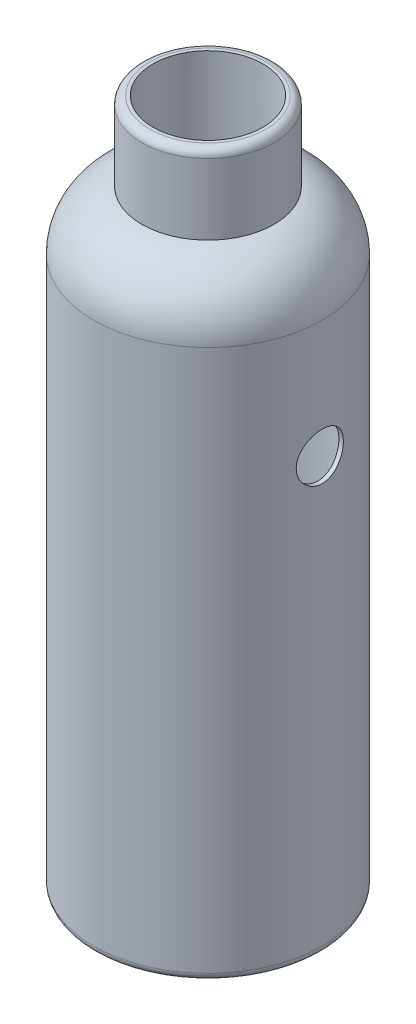
from build123d import *

# Parameters (mm, degrees)
SKETCH1_R               = 36.96335
BOSS_EXTRUDE1_DEPTH     = 171.45
FILLET1_R               = 2.54
SKETCH10_R              = 36.96335
BOSS_EXTRUDE2_DEPTH     = 25.4
FILLET2_R               = 19.05
SKETCH11_R              = 21.36775
BOSS_EXTRUDE3_DEPTH     = 25.4
FILLET3_R               = 2.54
SKETCH12_R              = 17.78
CUT_EXTRUDE1_DEPTH      = 221.742
SKETCH13_R              = 35.56
CUT_EXTRUDE2_DEPTH      = 171.45
CUT_EXTRUDE3_DEPTH      = 229.314784991
CUT_EXTRUDE3_DEPTH_BACK = 2.54
SKETCH15_R              = 7.62


with BuildPart() as part:
    # Sketch1 → Boss-Extrude1 (new body)
    with BuildSketch(Plane(origin=(0, 0, 0), x_dir=(1, 0, 0), z_dir=(0, 1, 0))):
        Circle(SKETCH1_R)
    extrude(amount=BOSS_EXTRUDE1_DEPTH)

    # Fillet1
    fillet1_edges = [part.edges().sort_by_distance(p)[0] for p in [
        (-36.96335, 0, 0),
    ]]
    fillet(fillet1_edges, radius=FILLET1_R)

    # Sketch10 → Boss-Extrude2 (add)
    with BuildSketch(Plane(origin=(0, 171.45, 0), x_dir=(1, 0, 0), z_dir=(0, 1, 0))):
        Circle(SKETCH10_R)
    extrude(amount=BOSS_EXTRUDE2_DEPTH)

    # Fillet2
    fillet2_edges = [part.edges().sort_by_distance(p)[0] for p in [
        (-36.96335, 196.85, 0),
    ]]
    fillet(fillet2_edges, radius=FILLET2_R)

    # Sketch11 → Boss-Extrude3 (add)
    with BuildSketch(Plane(origin=(0, 196.85, 0), x_dir=(1, 0, 0), z_dir=(0, 1, 0))):
        Circle(SKETCH11_R)
    extrude(amount=BOSS_EXTRUDE3_DEPTH)

    # Fillet3
    fillet3_edges = [part.edges().sort_by_distance(p)[0] for p in [
        (-21.36775, 222.25, 0),
    ]]
    fillet(fillet3_edges, radius=FILLET3_R)

    # Sketch12 → Cut-Extrude1 (cut)
    with BuildSketch(Plane(origin=(0, 222.25, 0), x_dir=(1, 0, 0), z_dir=(0, 1, 0))):
        Circle(SKETCH12_R)
    extrude(amount=-CUT_EXTRUDE1_DEPTH, mode=Mode.SUBTRACT)

    # Sketch13 → Cut-Extrude2 (cut)
    with BuildSketch(Plane(origin=(0, 0.508, 0), x_dir=(1, 0, 0), z_dir=(0, 1, 0))):
        Circle(SKETCH13_R)
    extrude(amount=CUT_EXTRUDE2_DEPTH, mode=Mode.SUBTRACT)

    # Sketch14 → Cut-Revolve1 (revolve, cut)
    with BuildSketch(Plane.XY):
        with BuildLine():
            Line((35.56, 171.958), (0, 171.958))
            Line((0, 171.958), (0, 196.85))
            Line((0, 196.85), (16.51, 196.85))
            ThreePointArc((16.51, 196.85), (29.980384182, 191.270384182), (35.56, 177.8))
            Line((35.56, 177.8), (35.56, 171.958))
        make_face()
    revolve(axis=Axis((0, 171.958, 0), (0, 1, 0)), mode=Mode.SUBTRACT)

    # Sketch15 → Cut-Extrude3 (cut, two sides: drawn at the far end of the back side and taken through both)
    with BuildSketch(Plane(origin=(0, 0, 0), x_dir=(0, 0, -1), z_dir=(1, 0, 0)).offset(-CUT_EXTRUDE3_DEPTH_BACK)):
        with Locations((0, 139.7)):
            Circle(SKETCH15_R)
    extrude(amount=CUT_EXTRUDE3_DEPTH + CUT_EXTRUDE3_DEPTH_BACK, mode=Mode.SUBTRACT)


solid = part.part
